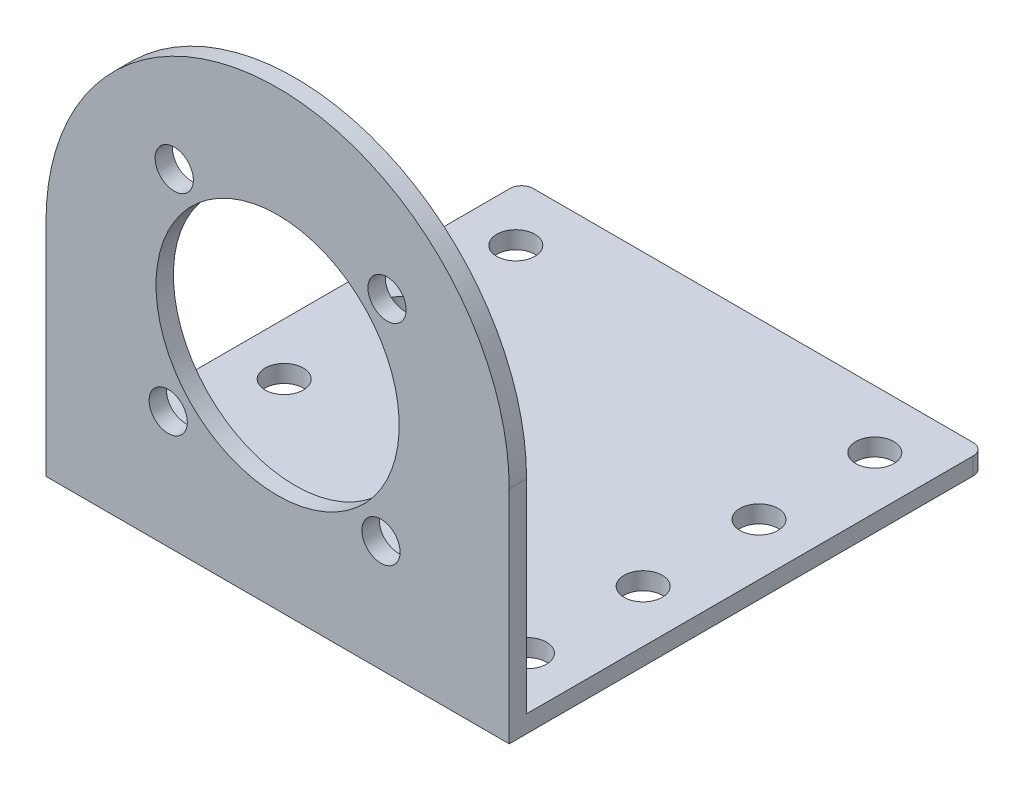
from build123d import *

# Parameters (mm, degrees)
SKETCH2_W           = 1.5
SKETCH2_H           = 37.57
SKETCH2_H_2         = 1.5
SKETCH2_W_2         = 39.569
BOSS_EXTRUDE1_DEPTH = 40
SKETCH3_R           = 1.65
CUT_EXTRUDE1_DEPTH  = 40
SKETCH4_R           = 10.5
SKETCH4_R_2         = 1.65
CUT_EXTRUDE2_DEPTH  = 40
FILLET1_R           = 1


with BuildPart() as part:
    # Sketch2 → Boss-Extrude1 (new body)
    with BuildSketch(Plane(origin=(0, 0, 0), x_dir=(0, 0, -1), z_dir=(1, 0, 0))):
        with Locations((-36.139408466, 17.750517241)):
            Rectangle(SKETCH2_W, SKETCH2_H)
        with Locations((-36.139408466, -1.784482759)):
            Rectangle(SKETCH2_W, SKETCH2_H_2)
        with Locations((-15.604908466, -1.784482759)):
            Rectangle(SKETCH2_W_2, SKETCH2_H_2)
    extrude(amount=BOSS_EXTRUDE1_DEPTH)

    # Sketch3 → Cut-Extrude1 (cut)
    with BuildSketch(Plane(origin=(0, -1.034482759, 0), x_dir=(1, 0, 0), z_dir=(0, 1, 0))):
        with Locations((4.5, -30.820408466)):
            Circle(SKETCH3_R)
        with Locations((4.5, -20.820408466)):
            Circle(SKETCH3_R)
        with Locations((4.5, -10.820408466)):
            Circle(SKETCH3_R)
        with Locations((4.5, -0.820408466)):
            Circle(SKETCH3_R)
        with Locations((35.5, -30.820408466)):
            Circle(SKETCH3_R)
        with Locations((35.5, -20.820408466)):
            Circle(SKETCH3_R)
        with Locations((35.5, -10.820408466)):
            Circle(SKETCH3_R)
        with Locations((35.5, -0.820408466)):
            Circle(SKETCH3_R)
    extrude(amount=-CUT_EXTRUDE1_DEPTH, mode=Mode.SUBTRACT)

    # Sketch4 → Cut-Extrude2 (cut)
    with BuildSketch(Plane(origin=(0, 0, 35.389408466), x_dir=(-1, 0, 0), z_dir=(0, 0, -1))):
        with Locations((-20, 16.535517241)):
            Circle(SKETCH4_R)
        with Locations((-11.070998723, 25.983952889)):
            Circle(SKETCH4_R_2)
        with Locations((-10.551564352, 7.606515964)):
            Circle(SKETCH4_R_2)
        with Locations((-29.448435648, 25.464518519)):
            Circle(SKETCH4_R_2)
        with Locations((-28.929001277, 7.087081594)):
            Circle(SKETCH4_R_2)
        with BuildLine():
            Line((-40, 36.535517241), (-40, 16.535517241))
            ThreePointArc((-40, 16.535517241), (-34.142135624, 30.677652865), (-20, 36.535517241))
            Line((-20, 36.535517241), (-40, 36.535517241))
        make_face()
        with BuildLine():
            Line((0, 36.535517241), (-20, 36.535517241))
            ThreePointArc((-20, 36.535517241), (-5.857864785, 30.677653274), (0, 16.535518399))
            Line((0, 16.535518399), (0, 36.535517241))
        make_face()
    extrude(amount=-CUT_EXTRUDE2_DEPTH, mode=Mode.SUBTRACT)

    # Fillet1
    fillet1_edges = [part.edges().sort_by_distance(p)[0] for p in [
        (0, -1.784482759, -4.179591534),
        (40, -1.784482759, -4.179591534),
    ]]
    fillet(fillet1_edges, radius=FILLET1_R)


solid = part.part
